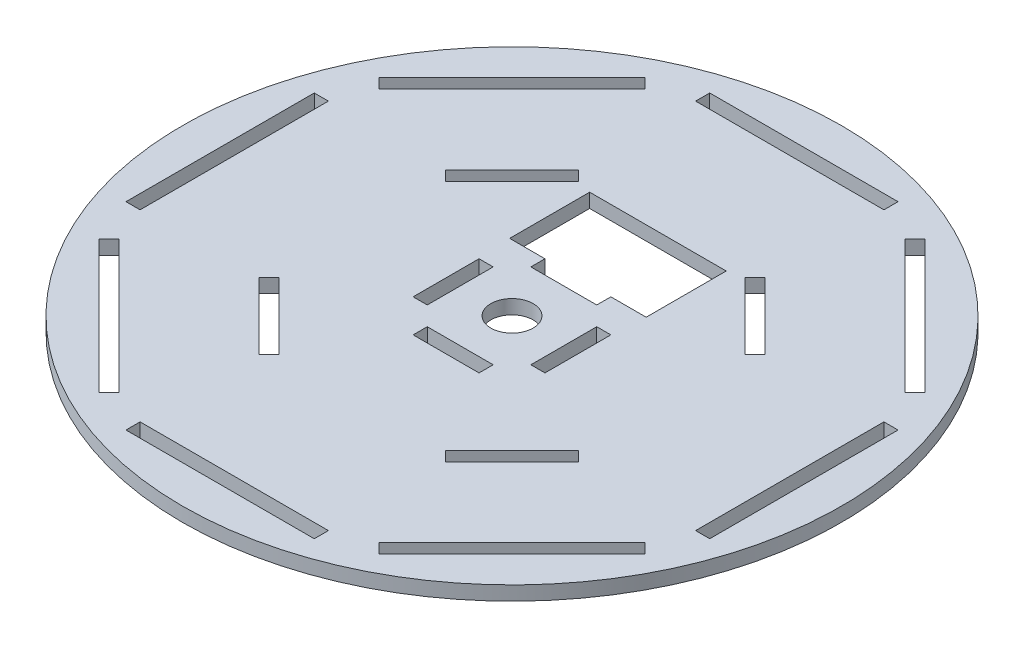
from build123d import *

# Parameters (mm, degrees)
CROQUIS1_R              = 70
CROQUIS1_R_2            = 4.5
SALIENTE_EXTRUIR1_DEPTH = 3


with BuildPart() as part:
    # Croquis1 → Saliente-Extruir1 (new body)
    with BuildSketch(Plane(origin=(0, 0, 0), x_dir=(1, 0, 0), z_dir=(0, 1, 0))):
        Circle(CROQUIS1_R)
        Circle(CROQUIS1_R_2, mode=Mode.SUBTRACT)
        Polygon((0, 11), (7, 11), (7, 14), (14.5, 14), (14.5, 31), (-14.5, 31), (-14.5, 14), (-7, 14), (-7, 11), align=None, mode=Mode.SUBTRACT)
        Polygon((24.748737342, 24.748737342), (31.819805153, 17.67766953), (33.941125497, 19.798989873), (19.798989873, 33.941125497), (17.67766953, 31.819805153), align=None, mode=Mode.SUBTRACT)
        Polygon((11, 0), (11, 7), (14, 7), (14, -7), (11, -7), align=None, mode=Mode.SUBTRACT)
        Polygon((-24.748737342, 24.748737342), (-17.67766953, 31.819805153), (-19.798989873, 33.941125497), (-33.941125497, 19.798989873), (-31.819805153, 17.67766953), align=None, mode=Mode.SUBTRACT)
        Polygon((-14, -7), (-11, -7), (-11, 0), (-11, 7), (-14, 7), align=None, mode=Mode.SUBTRACT)
        Polygon((7, -11), (7, -14), (-7, -14), (-7, -11), (0, -11), align=None, mode=Mode.SUBTRACT)
        Polygon((24.748737342, -24.748737342), (17.67766953, -31.819805153), (19.798989873, -33.941125497), (33.941125497, -19.798989873), (31.819805153, -17.67766953), align=None, mode=Mode.SUBTRACT)
        Polygon((-24.748737342, -24.748737342), (-31.819805153, -17.67766953), (-33.941125497, -19.798989873), (-19.798989873, -33.941125497), (-17.67766953, -31.819805153), align=None, mode=Mode.SUBTRACT)
        Polygon((0, 62), (20, 62), (20, 59), (-20, 59), (-20, 62), align=None, mode=Mode.SUBTRACT)
        Polygon((55.861435714, 27.577164466), (27.577164466, 55.861435714), (29.69848481, 57.982756057), (43.840620434, 43.840620434), (57.982756057, 29.69848481), align=None, mode=Mode.SUBTRACT)
        Polygon((59, -20), (59, 20), (62, 20), (62, 0), (62, -20), align=None, mode=Mode.SUBTRACT)
        Polygon((27.577164466, -55.861435714), (55.861435714, -27.577164466), (57.982756057, -29.69848481), (43.840620434, -43.840620434), (29.69848481, -57.982756057), align=None, mode=Mode.SUBTRACT)
        Polygon((-20, -59), (20, -59), (20, -62), (0, -62), (-20, -62), align=None, mode=Mode.SUBTRACT)
        Polygon((-55.861435714, -27.577164466), (-27.577164466, -55.861435714), (-29.69848481, -57.982756057), (-43.840620434, -43.840620434), (-57.982756057, -29.69848481), align=None, mode=Mode.SUBTRACT)
        Polygon((-59, 20), (-59, -20), (-62, -20), (-62, 0), (-62, 20), align=None, mode=Mode.SUBTRACT)
        Polygon((-27.577164466, 55.861435714), (-55.861435714, 27.577164466), (-57.982756057, 29.69848481), (-43.840620434, 43.840620434), (-29.69848481, 57.982756057), align=None, mode=Mode.SUBTRACT)
    extrude(amount=SALIENTE_EXTRUIR1_DEPTH)


solid = part.part
